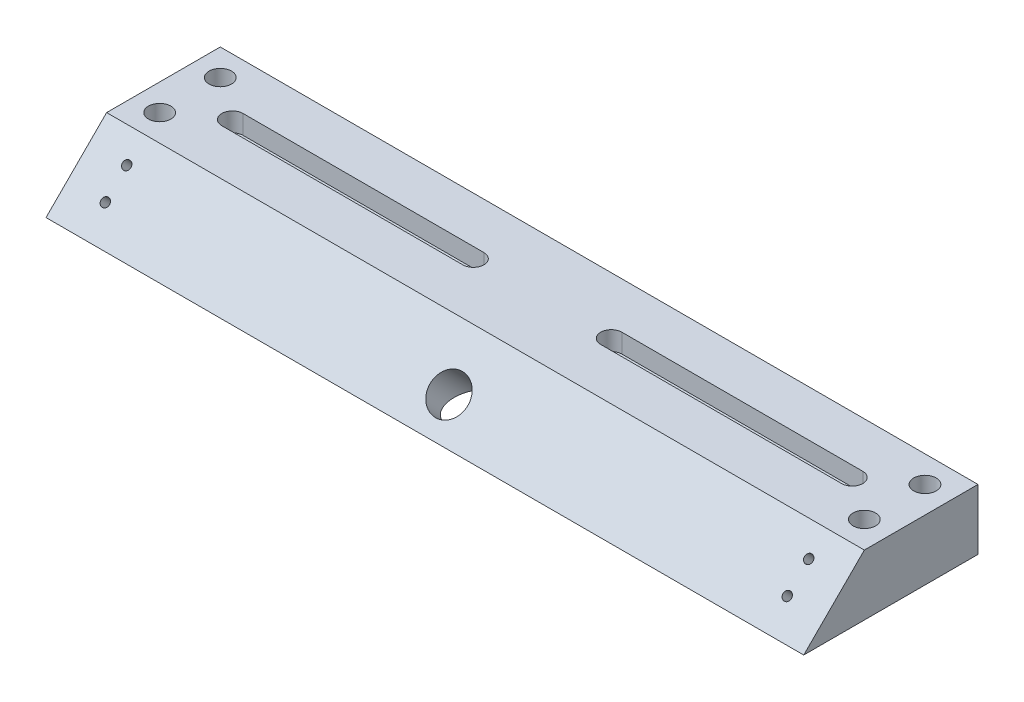
from build123d import *

# Parameters (mm, degrees)
SKETCH1_W           = 254
SKETCH1_H           = 63.5
BOSS_EXTRUDE1_DEPTH = 20.32
CHAMFER1_SIZE       = 25.4
CUT_EXTRUDE1_DEPTH  = 6.35
SKETCH3_R           = 3.7719
CUT_EXTRUDE2_DEPTH  = 133.476280518
SKETCH4_R           = 1.4224
CUT_EXTRUDE3_DEPTH  = 7.366
SKETCH5_R           = 6.35
CUT_EXTRUDE4_DEPTH  = 136.423334215


with BuildPart() as part:
    # Sketch1 → Boss-Extrude1 (new body)
    with BuildSketch(Plane(origin=(0, 0, 0), x_dir=(1, 0, 0), z_dir=(0, 1, 0))):
        Rectangle(SKETCH1_W, SKETCH1_H)
    extrude(amount=BOSS_EXTRUDE1_DEPTH)

    # Chamfer1
    # the kernel refuses this chamfer: 25.4 mm, written as the material it takes off along each edge
    with BuildSketch(Plane(origin=(-192.320747894, 20.32, 31.75), x_dir=(0, -0.9996219169112966, 0.02749587661058647), z_dir=(1, 0, 0))) as chamfer1_piece_1:
        Polygon((CHAMFER1_SIZE * 0.999621916911, CHAMFER1_SIZE * 0.0274958766106), (-CHAMFER1_SIZE * 0.0274958766106, CHAMFER1_SIZE * 0.999621916911), (0, 0), align=None)
    extrude(amount=384.641495789, mode=Mode.SUBTRACT)

    # Sketch2 → Cut-Extrude1 (cut)
    with BuildSketch(Plane(origin=(0, 20.32, 0), x_dir=(1, 0, 0), z_dir=(0, 1, 0))):
        with BuildLine():
            ThreePointArc((-107.442, 12.7), (-106.400471714, 10.185528286), (-103.886, 9.144))
            Line((-103.886, 9.144), (-23.114, 9.144))
            ThreePointArc((-23.114, 9.144), (-20.599528286, 10.185528286), (-19.558, 12.7))
            ThreePointArc((-19.558, 12.7), (-20.599528286, 15.214471714), (-23.114, 16.256))
            Line((-23.114, 16.256), (-103.886, 16.256))
            ThreePointArc((-103.886, 16.256), (-106.400471714, 15.214471714), (-107.442, 12.7))
        make_face()
    cut_extrude1 = extrude(amount=-CUT_EXTRUDE1_DEPTH, mode=Mode.SUBTRACT)

    # Sketch3 → Cut-Extrude2 (cut, through all)
    with BuildSketch(Plane(origin=(0, 20.32, 0), x_dir=(1, 0, 0), z_dir=(0, 1, 0))):
        with Locations(Location((-118.11, 2.54, 0), (0, 0, 270))):
            Circle(SKETCH3_R)
        with Locations(Location((-118.11, 22.86, 0), (0, 0, 90))):
            Circle(SKETCH3_R)
        with Locations(Location((118.11, 2.54, 0), (0, 0, 90))):
            Circle(SKETCH3_R)
        with Locations(Location((118.11, 22.86, 0), (0, 0, 270))):
            Circle(SKETCH3_R)
    extrude(amount=-CUT_EXTRUDE2_DEPTH, mode=Mode.SUBTRACT)

    # Mirror1: Cut-Extrude1 across plane
    add(cut_extrude1.mirror(Plane.ZY), mode=Mode.SUBTRACT)

    # Sketch4 → Cut-Extrude3 (cut)
    with BuildSketch(Plane(origin=(0, 13.335, 13.335), x_dir=(1, 0, 0), z_dir=(0, 0.7071067811865464, 0.7071067811865487))):
        with Locations(Location((-114.3, -8.698537854, 0), (0, 0, 90))):
            Circle(SKETCH4_R)
        with Locations(Location((-114.3, 1.461462146, 0), (0, 0, 270))):
            Circle(SKETCH4_R)
        with Locations(Location((114.3, -8.698537854, 0), (0, 0, 270))):
            Circle(SKETCH4_R)
        with Locations(Location((114.3, 1.461462146, 0), (0, 0, 90))):
            Circle(SKETCH4_R)
    extrude(amount=-CUT_EXTRUDE3_DEPTH, mode=Mode.SUBTRACT)

    # Sketch5 → Cut-Extrude4 (cut, through all)
    with BuildSketch(Plane(origin=(0, 13.335, 13.335), x_dir=(1, 0, 0), z_dir=(0, 0.7071067811865511, 0.707106781186544))):
        with Locations(Location((0, -7.428537854, 0), (0, 0, 270))):
            Circle(SKETCH5_R)
    extrude(amount=-CUT_EXTRUDE4_DEPTH, mode=Mode.SUBTRACT)


solid = part.part
